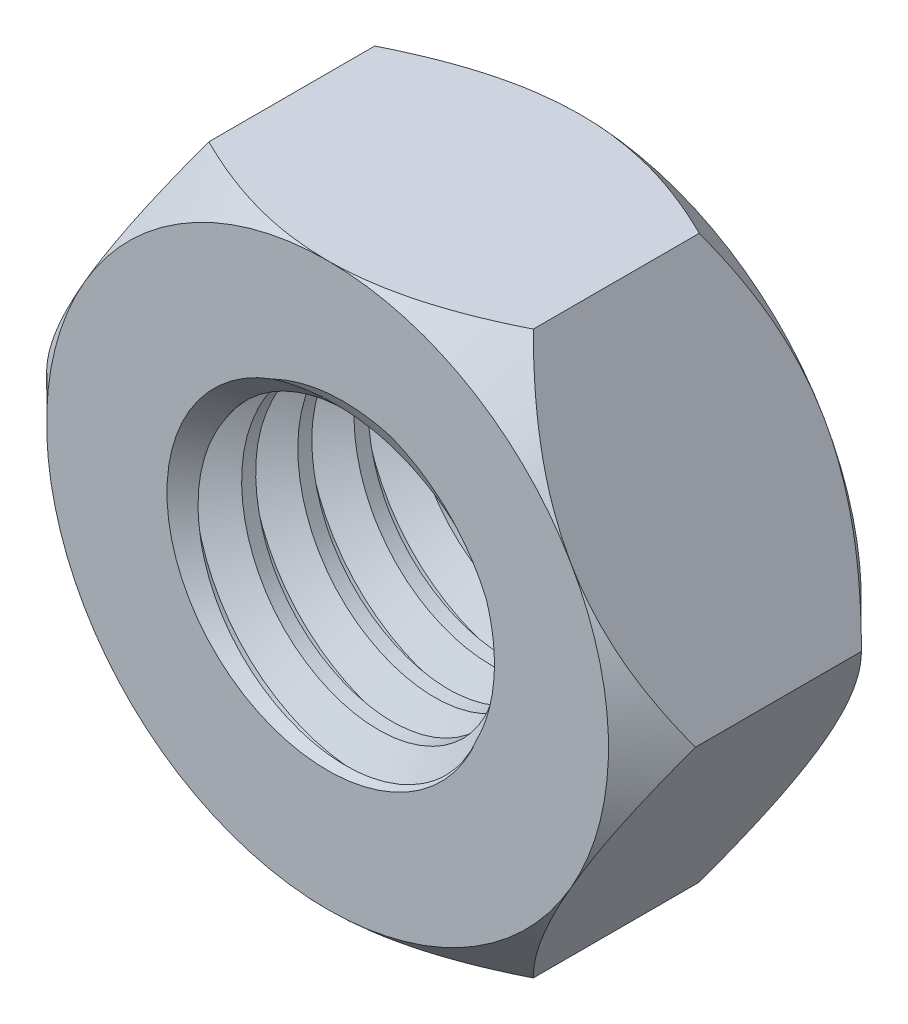
from build123d import *

# Parameters (mm, degrees)
BOSS_EXTRUDE1_DEPTH     = 1.35
SKETCH2_OUTSIDE_W       = 23.476
SKETCH2_OUTSIDE_H       = 22.548
SKETCH2_OUTSIDE_R       = 3
CUT_EXTRUDE1_DEPTH      = 6.318834459
CUT_EXTRUDE1_DRAFT      = -45
MIRROR1_COPY_1_SKETCH_W = 23.476
MIRROR1_COPY_1_SKETCH_H = 22.548
MIRROR1_COPY_1_SKETCH_R = 3
MIRROR1_COPY_1_DEPTH    = 6.318834459
MIRROR1_COPY_1_DRAFT    = -45
SKETCH3_R               = 1.515
CUT_EXTRUDE2_DEPTH      = 6.318834459
CHAMFER1_SIZE           = 0.2
THREAD1_PITCH           = 0.6


with BuildPart() as part:
    # Sketch1 → Boss-Extrude1 (new, symmetric)
    with BuildSketch(Plane.XY):
        Polygon((1.732050808, -3), (3.464101615, 0), (1.732050808, 3), (-1.732050808, 3), (-3.464101615, 0), (-1.732050808, -3), align=None)
    extrude(amount=BOSS_EXTRUDE1_DEPTH, both=True)


with BuildPart() as cut_extrude1_tool:
    # Sketch2 outside → Cut-Extrude1 (with draft: the straight prism first)
    with BuildSketch(Plane.XY.offset(1.35)):
        Rectangle(SKETCH2_OUTSIDE_W, SKETCH2_OUTSIDE_H)
        Circle(SKETCH2_OUTSIDE_R, mode=Mode.SUBTRACT)
    extrude(amount=-CUT_EXTRUDE1_DEPTH)
    # Cut-Extrude1: the draft: its side faces are tilted about the plane it starts from
    cut_extrude1_sides = [cut_extrude1_tool.faces().sort_by_distance(p)[0] for p in [
        (0, -11.274, -1.809417229),
        (11.738, 0, -1.809417229),
        (0, 11.274, -1.809417229),
        (-11.738, 0, -1.809417229),
        (-3, 0, -1.809417229),
    ]]
    draft(cut_extrude1_sides, Plane.XY.offset(1.35), CUT_EXTRUDE1_DRAFT)


with BuildPart() as part_1:
    add(part.part)

    # Cut-Extrude1: cut by cut_extrude1_tool
    add(cut_extrude1_tool.part, mode=Mode.SUBTRACT)


with BuildPart() as mirror1_copy_1_tool:
    # Mirror1 copy 1 sketch → Mirror1 copy 1 (with draft: the straight prism first)
    with BuildSketch(Plane(origin=(0, 0, -1.35), x_dir=(1, 0, 0), z_dir=(0, 0, -1))):
        Rectangle(MIRROR1_COPY_1_SKETCH_W, MIRROR1_COPY_1_SKETCH_H)
        Circle(MIRROR1_COPY_1_SKETCH_R, mode=Mode.SUBTRACT)
    extrude(amount=-MIRROR1_COPY_1_DEPTH)
    # Mirror1 copy 1: the draft: its side faces are tilted about the plane it starts from
    mirror1_copy_1_sides = [mirror1_copy_1_tool.faces().sort_by_distance(p)[0] for p in [
        (0, -11.274, 1.809417229),
        (11.738, 0, 1.809417229),
        (0, 11.274, 1.809417229),
        (-11.738, 0, 1.809417229),
        (-3, 0, 1.809417229),
    ]]
    draft(mirror1_copy_1_sides, Plane(origin=(0, 0, -1.35), x_dir=(1, 0, 0), z_dir=(0, 0, -1)), MIRROR1_COPY_1_DRAFT)


with BuildPart() as part_2:
    add(part_1.part)

    # Mirror1 copy 1: cut by mirror1_copy_1_tool
    add(mirror1_copy_1_tool.part, mode=Mode.SUBTRACT)

    # Sketch3 → Cut-Extrude2 (cut, through all)
    with BuildSketch(Plane.XY.offset(1.35)):
        Circle(SKETCH3_R)
    extrude(amount=-CUT_EXTRUDE2_DEPTH, mode=Mode.SUBTRACT)

    # Chamfer1
    chamfer1_edges = [part_2.edges().sort_by_distance(p)[0] for p in [
        (-1.515, 0, -1.35),
        (-1.515, 0, 1.35),
    ]]
    chamfer(chamfer1_edges, length=CHAMFER1_SIZE)

    # Thread1: the profile of Thread Profile1 profile screwed along a right-hand helix of 7.5 turns, 6 arcs to a turn; built about Z, then put on its axis
    thread1_z = Axis((0, 0, 0), (0, 0, 1))
    thread1_corners = [(1.5147, 0, -0.000173205), (1.839759525, 0, 0.187499999), (1.839759525, 0, 0.262499999), (1.5147, 0, 0.450173203)]
    with BuildLine(mode=Mode.PRIVATE) as thread1_profile:
        Line(thread1_corners[0], thread1_corners[1])
        Line(thread1_corners[1], thread1_corners[2])
        Line(thread1_corners[2], thread1_corners[3])
        Line(thread1_corners[3], thread1_corners[0])
    thread1_cap = Face(thread1_profile.wire())
    thread1_turn_angles = [0, 30, 60, 90, 120, 150, 180, 210, 240, 270, 300, 330, 360]
    thread1_turn_weights = [1, 0.8660254037844387, 1, 0.8660254037844387, 1, 0.8660254037844387, 1, 0.8660254037844387, 1, 0.8660254037844387, 1, 0.8660254037844387, 1]
    thread1_turn_rails = [Edge.make_bspline([Vector(p[0], p[1], 0).rotate(thread1_z, thread1_turn_angles[k]) / thread1_turn_weights[k] + Vector(0, 0, p[2] + THREAD1_PITCH * thread1_turn_angles[k] / 360) for k in range(13)], [0, 0, 0, 1, 1, 2, 2, 3, 3, 4, 4, 5, 5, 6, 6, 6], 2, thread1_turn_weights) for p in thread1_corners]
    thread1_turn_sides = [Face.make_surface_from_curves(thread1_turn_rails[p[0]], thread1_turn_rails[p[1]]) for p in [(0, 1), (1, 2), (2, 3), (3, 0)]]
    thread1_last_angles = [2520, 2550, 2580, 2610, 2640, 2670, 2700]
    thread1_last_weights = [1, 0.8660254037844387, 1, 0.8660254037844387, 1, 0.8660254037844367, 1]
    thread1_last_rails = [Edge.make_bspline([Vector(p[0], p[1], 0).rotate(thread1_z, thread1_last_angles[k]) / thread1_last_weights[k] + Vector(0, 0, p[2] + THREAD1_PITCH * thread1_last_angles[k] / 360) for k in range(7)], [0, 0, 0, 1, 1, 2, 2, 3, 3, 3], 2, thread1_last_weights) for p in thread1_corners]
    thread1_last_sides = [Face.make_surface_from_curves(thread1_last_rails[p[0]], thread1_last_rails[p[1]]) for p in [(0, 1), (1, 2), (2, 3), (3, 0)]]
    thread1 = Plane(origin=(0, 0, -3.15), x_dir=(1, 0, 0), z_dir=(0, 0, 1)) * Solid(Shell([*[p.moved(Location((0, 0, THREAD1_PITCH * i))) for i in range(7) for p in thread1_turn_sides], *thread1_last_sides, thread1_cap, thread1_cap.rotate(thread1_z, 2700).moved(Location((0, 0, THREAD1_PITCH * 2700 / 360)))]))
    add(thread1, mode=Mode.SUBTRACT)


solid = part_2.part
